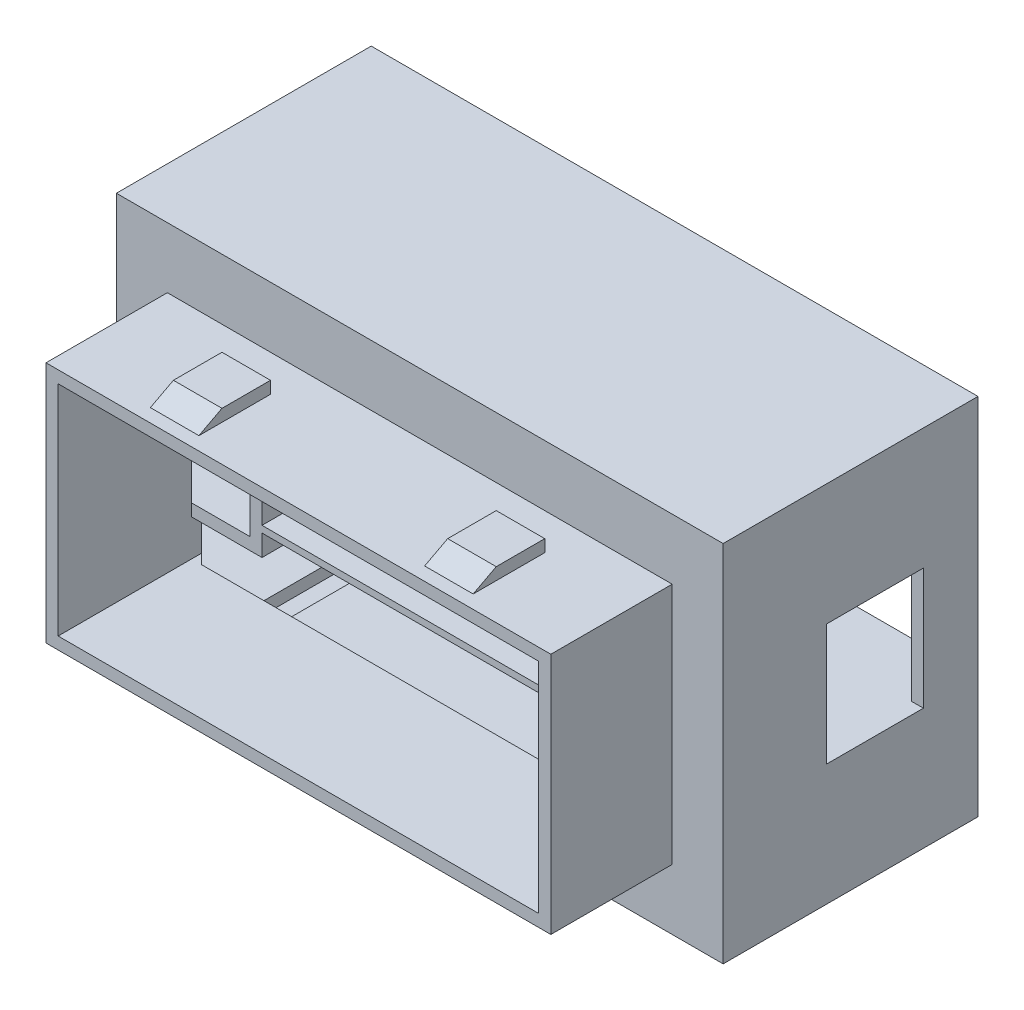
from build123d import *

# Parameters (mm, degrees)
SKETCH1_W            = 41.6
SKETCH1_H            = 20
SKETCH1_W_2          = 39.6
SKETCH1_H_2          = 18
BOSS_EXTRUDE2_DEPTH  = 10
SKETCH2_W            = 4
SKETCH2_H            = 10
BOSS_EXTRUDE3_DEPTH  = 1
SKETCH3_W            = 3
SKETCH3_H            = 1
CUT_EXTRUDE1_DEPTH   = 27
SKETCH4_W            = 4
SKETCH4_H            = 10
BOSS_EXTRUDE4_DEPTH  = 1
SKETCH5_W            = 3
SKETCH5_H            = 1
CUT_EXTRUDE2_DEPTH   = 27
SKETCH6_W            = 50
SKETCH6_H            = 30
SKETCH6_W_2          = 41.6
SKETCH6_H_2          = 20
SKETCH6_W_3          = 39.6
SKETCH6_H_3          = 18
BOSS_EXTRUDE6_DEPTH  = 1
SKETCH7_W            = 50
SKETCH7_H            = 30
SKETCH7_W_2          = 48
SKETCH7_H_2          = 28
BOSS_EXTRUDE7_DEPTH  = 20
SKETCH8_W            = 4.2
SKETCH8_H            = 1
BOSS_EXTRUDE8_DEPTH  = 20
SKETCH9_W            = 4.2
SKETCH9_H            = 1
BOSS_EXTRUDE9_DEPTH  = 20
SKETCH10_W           = 4
SKETCH10_H           = 4
BOSS_EXTRUDE10_DEPTH = 20
SKETCH11_W           = 2
SKETCH11_H           = 10
CUT_EXTRUDE3_DEPTH   = 1
SKETCH12_W           = 2
SKETCH12_H           = 10
CUT_EXTRUDE4_DEPTH   = 1
SKETCH13_R           = 1.5
CUT_EXTRUDE5_DEPTH   = 10
CHAMFER2_SIZE        = 5
CHAMFER3_SIZE        = 5
CHAMFER4_SIZE        = 4
SKETCH16_W           = 1.2
SKETCH16_H           = 1
BOSS_EXTRUDE11_DEPTH = 20
BOSS_EXTRUDE12_DEPTH = 20
SKETCH18_W           = 28
SKETCH18_H           = 0.549749779
BOSS_EXTRUDE13_DEPTH = 20


# Some blends are built 0.0001 mm under size
with BuildPart() as part:
    # Sketch1 → Boss-Extrude2 (new body)
    with BuildSketch(Plane.XY):
        Rectangle(SKETCH1_W, SKETCH1_H)
        Rectangle(SKETCH1_W_2, SKETCH1_H_2, mode=Mode.SUBTRACT)
    extrude(amount=BOSS_EXTRUDE2_DEPTH)

    # Sketch2 → Boss-Extrude3 (add)
    with BuildSketch(Plane.XZ.offset(10)):
        with Locations((-11.3, 5)):
            Rectangle(SKETCH2_W, SKETCH2_H)
        with Locations((11.3, 5)):
            Rectangle(SKETCH2_W, SKETCH2_H)
    extrude(amount=BOSS_EXTRUDE3_DEPTH)

    # Sketch3 → Cut-Extrude1 (cut)
    with BuildSketch(Plane.ZY.offset(13.3)):
        Polygon((8.900149248, -10), (7, -11), (10, -11), (10, -10), align=None)
        with Locations((1.5, -10.5)):
            Rectangle(SKETCH3_W, SKETCH3_H)
    extrude(amount=-CUT_EXTRUDE1_DEPTH, mode=Mode.SUBTRACT)

    # Sketch4 → Boss-Extrude4 (add)
    with BuildSketch(Plane(origin=(0, 10, 0), x_dir=(1, 0, 0), z_dir=(0, 1, 0))):
        with Locations((11.3, -5)):
            Rectangle(SKETCH4_W, SKETCH4_H)
        with Locations((-11.3, -5)):
            Rectangle(SKETCH4_W, SKETCH4_H)
    extrude(amount=BOSS_EXTRUDE4_DEPTH)

    # Sketch5 → Cut-Extrude2 (cut)
    with BuildSketch(Plane(origin=(13.3, 0, 0), x_dir=(0, 0, -1), z_dir=(1, 0, 0))):
        Polygon((-7, 11), (-10, 11), (-10, 10), (-8.900149248, 10), align=None)
        with Locations((-1.5, 10.5)):
            Rectangle(SKETCH5_W, SKETCH5_H)
    extrude(amount=-CUT_EXTRUDE2_DEPTH, mode=Mode.SUBTRACT)

    # Sketch6 → Boss-Extrude6 (add)
    # profile 1 of 2: a face of its own
    with BuildSketch(Plane(origin=(0, 0, 0), x_dir=(-1, 0, 0), z_dir=(0, 0, -1))):
        Rectangle(SKETCH6_W, SKETCH6_H)
        Rectangle(SKETCH6_W_2, SKETCH6_H_2, mode=Mode.SUBTRACT)
    # profile 2 of 2: a face of its own
    with BuildSketch(Plane(origin=(0, 0, 0), x_dir=(-1, 0, 0), z_dir=(0, 0, -1))):
        Rectangle(SKETCH6_W_2, SKETCH6_H_2)
        Rectangle(SKETCH6_W_3, SKETCH6_H_3, mode=Mode.SUBTRACT)
    extrude(amount=BOSS_EXTRUDE6_DEPTH)

    # Sketch7 → Boss-Extrude7 (add)
    with BuildSketch(Plane(origin=(0, 0, -1), x_dir=(-1, 0, 0), z_dir=(0, 0, -1))):
        Rectangle(SKETCH7_W, SKETCH7_H)
        Rectangle(SKETCH7_W_2, SKETCH7_H_2, mode=Mode.SUBTRACT)
    extrude(amount=BOSS_EXTRUDE7_DEPTH)

    # Sketch8 → Boss-Extrude8 (add)
    with BuildSketch(Plane(origin=(0, 0, -1), x_dir=(-1, 0, 0), z_dir=(0, 0, -1))):
        Polygon((-15, -5), (-19.8, -5), (-19.8, -6), (-14, -6), (-14, 6), (-19.8, 6), (-19.8, 5), (-15, 5), align=None)
        with Locations((-21.9, 5.5)):
            Rectangle(SKETCH8_W, SKETCH8_H)
        with Locations((-21.9, -5.5)):
            Rectangle(SKETCH8_W, SKETCH8_H)
    extrude(amount=BOSS_EXTRUDE8_DEPTH)

    # Sketch9 → Boss-Extrude9 (add)
    with BuildSketch(Plane(origin=(0, 0, -1), x_dir=(-1, 0, 0), z_dir=(0, 0, -1))):
        Polygon((15, 5), (19.8, 5), (19.8, 6), (14, 6), (14, -6), (19.8, -6), (19.8, -5), (15, -5), align=None)
        with Locations((21.9, 5.5)):
            Rectangle(SKETCH9_W, SKETCH9_H)
        with Locations((21.9, -5.5)):
            Rectangle(SKETCH9_W, SKETCH9_H)
    extrude(amount=BOSS_EXTRUDE9_DEPTH)

    # Sketch10 → Boss-Extrude10 (add)
    with BuildSketch(Plane(origin=(0, 0, -1), x_dir=(-1, 0, 0), z_dir=(0, 0, -1))):
        with Locations((-22, 12)):
            Rectangle(SKETCH10_W, SKETCH10_H)
        with Locations((22, 12)):
            Rectangle(SKETCH10_W, SKETCH10_H)
        with Locations((22, -12)):
            Rectangle(SKETCH10_W, SKETCH10_H)
        with Locations((-22, -12)):
            Rectangle(SKETCH10_W, SKETCH10_H)
    extrude(amount=BOSS_EXTRUDE10_DEPTH)

    # Sketch11 → Cut-Extrude3 (cut)
    with BuildSketch(Plane.ZY.offset(25)):
        Polygon((-10.5, -5), (-10.5, 5), (-16.5, 5), (-16.5, 0), (-16.5, -5), align=None)
        with Locations((-9.5, 0)):
            Rectangle(SKETCH11_W, SKETCH11_H)
    extrude(amount=-CUT_EXTRUDE3_DEPTH, mode=Mode.SUBTRACT)

    # Sketch12 → Cut-Extrude4 (cut)
    with BuildSketch(Plane(origin=(25, 0, 0), x_dir=(0, 0, -1), z_dir=(1, 0, 0))):
        with Locations((9.5, 0)):
            Rectangle(SKETCH12_W, SKETCH12_H)
        Polygon((16.5, 5), (10.5, 5), (10.5, -5), (16.5, -5), (16.5, 0), align=None)
    extrude(amount=-CUT_EXTRUDE4_DEPTH, mode=Mode.SUBTRACT)

    # Sketch13 → Cut-Extrude5 (cut)
    with BuildSketch(Plane(origin=(0, 0, -21), x_dir=(-1, 0, 0), z_dir=(0, 0, -1))):
        with Locations((-22.5, 12.5)):
            Circle(SKETCH13_R)
        with Locations((22.5, 12.5)):
            Circle(SKETCH13_R)
        with Locations((22.5, -12.5)):
            Circle(SKETCH13_R)
        with Locations((-22.5, -12.5)):
            Circle(SKETCH13_R)
    extrude(amount=-CUT_EXTRUDE5_DEPTH, mode=Mode.SUBTRACT)

    # Chamfer2
    chamfer2_edges = [part.edges().sort_by_distance(p)[0] for p in [
        (0, 14, -1),
        (0, -14, -1),
    ]]
    chamfer(chamfer2_edges, length=CHAMFER2_SIZE - 0.0001)  # a hair under: the kernel refuses the full size

    # Chamfer3
    # the kernel refuses this chamfer: 5 mm, written as the material it adds along each edge
    with BuildSketch(Plane(origin=(24, -21.85851494, -1), x_dir=(-0.9996219169112968, 0, 0.02749587661058636), z_dir=(0, 1, 0))) as chamfer3_piece_1_section:
        Polygon((CHAMFER3_SIZE * 0.999621916911, -CHAMFER3_SIZE * 0.0274958766106), (-CHAMFER3_SIZE * 0.0274958766106, -CHAMFER3_SIZE * 0.999621916911), (0, 0), align=None)
    chamfer3_piece_1 = extrude(amount=28.71692988, mode=Mode.PRIVATE)
    chamfer3_piece_1 = split(chamfer3_piece_1, bisect_by=Plane(origin=(19.8, -10.000025, -1.99995), z_dir=(1, 0, 0)), keep=Keep.TOP, mode=Mode.PRIVATE)
    chamfer3_piece_1 = split(chamfer3_piece_1, bisect_by=Plane(origin=(19.999975, -5, -1.99995), z_dir=(0, -1, 0)), keep=Keep.TOP, mode=Mode.PRIVATE)
    chamfer3_piece_1 = split(chamfer3_piece_1, bisect_by=Plane(origin=(19.999975, -10.0000375, -1.9999375), z_dir=(0, 0.7071067811865476, -0.7071067811865476)), keep=Keep.TOP, mode=Mode.PRIVATE)
    add(chamfer3_piece_1)
    with BuildSketch(Plane(origin=(24, -21.85851494, -1), x_dir=(-0.9996219169112968, 0, 0.02749587661058636), z_dir=(0, 1, 0))) as chamfer3_piece_2_section:
        Polygon((CHAMFER3_SIZE * 0.999621916911, -CHAMFER3_SIZE * 0.0274958766106), (-CHAMFER3_SIZE * 0.0274958766106, -CHAMFER3_SIZE * 0.999621916911), (0, 0), align=None)
    chamfer3_piece_2 = extrude(amount=28.71692988, mode=Mode.PRIVATE)
    chamfer3_piece_2 = split(chamfer3_piece_2, bisect_by=Plane(origin=(19.599975009, -9, -1.399950019), z_dir=(0, -1, 0)), keep=Keep.TOP, mode=Mode.PRIVATE)
    chamfer3_piece_2 = split(chamfer3_piece_2, bisect_by=Plane(origin=(19.599975009, -9.300037514, -1.299937514), z_dir=(0, 0.7071067811865476, -0.7071067811865476)), keep=Keep.TOP, mode=Mode.PRIVATE)
    add(chamfer3_piece_2)
    with BuildSketch(Plane(origin=(24, -21.85851494, -1), x_dir=(-0.9996219169112968, 0, 0.02749587661058636), z_dir=(0, 1, 0))) as chamfer3_piece_3_section:
        Polygon((CHAMFER3_SIZE * 0.999621916911, -CHAMFER3_SIZE * 0.0274958766106), (-CHAMFER3_SIZE * 0.0274958766106, -CHAMFER3_SIZE * 0.999621916911), (0, 0), align=None)
    chamfer3_piece_3 = extrude(amount=28.71692988, mode=Mode.PRIVATE)
    chamfer3_piece_3 = split(chamfer3_piece_3, bisect_by=Plane(origin=(19.8, 6.42920747, -1.451851852), z_dir=(1, 0, 0)), keep=Keep.TOP, mode=Mode.PRIVATE)
    chamfer3_piece_3 = split(chamfer3_piece_3, bisect_by=Plane(origin=(19.903703704, 5, -1.451851852), z_dir=(0, 1, 0)), keep=Keep.TOP, mode=Mode.PRIVATE)
    add(chamfer3_piece_3)
    with BuildSketch(Plane(origin=(-24, 21.85851494, -1), x_dir=(0.9996219169112968, 0, 0.02749587661058636), z_dir=(0, -1, 0))) as chamfer3_piece_4_section:
        Polygon((CHAMFER3_SIZE * 0.999621916911, -CHAMFER3_SIZE * 0.0274958766106), (-CHAMFER3_SIZE * 0.0274958766106, -CHAMFER3_SIZE * 0.999621916911), (0, 0), align=None)
    chamfer3_piece_4 = extrude(amount=28.71692988, mode=Mode.PRIVATE)
    chamfer3_piece_4 = split(chamfer3_piece_4, bisect_by=Plane(origin=(-19.8, 10.000025, -1.99995), z_dir=(-1, 0, 0)), keep=Keep.TOP, mode=Mode.PRIVATE)
    chamfer3_piece_4 = split(chamfer3_piece_4, bisect_by=Plane(origin=(-19.999975, 15, -1.99995), z_dir=(0, -1, 0)), keep=Keep.TOP, mode=Mode.PRIVATE)
    chamfer3_piece_4 = split(chamfer3_piece_4, bisect_by=Plane(origin=(-19.999975, 5, -1.99995), z_dir=(0, 1, 0)), keep=Keep.TOP, mode=Mode.PRIVATE)
    add(chamfer3_piece_4)
    with BuildSketch(Plane(origin=(-24, 21.85851494, -1), x_dir=(0.9996219169112968, 0, 0.02749587661058636), z_dir=(0, -1, 0))) as chamfer3_piece_5_section:
        Polygon((CHAMFER3_SIZE * 0.999621916911, -CHAMFER3_SIZE * 0.0274958766106), (-CHAMFER3_SIZE * 0.0274958766106, -CHAMFER3_SIZE * 0.999621916911), (0, 0), align=None)
    chamfer3_piece_5 = extrude(amount=28.71692988, mode=Mode.PRIVATE)
    chamfer3_piece_5 = split(chamfer3_piece_5, bisect_by=Plane(origin=(-19.599975009, 9, -1.399950019), z_dir=(0, 1, 0)), keep=Keep.TOP, mode=Mode.PRIVATE)
    chamfer3_piece_5 = split(chamfer3_piece_5, bisect_by=Plane(origin=(-19.599975009, 15, -1.399950019), z_dir=(0, -1, 0)), keep=Keep.TOP, mode=Mode.PRIVATE)
    add(chamfer3_piece_5)
    with BuildSketch(Plane(origin=(-24, 21.85851494, -1), x_dir=(0.9996219169112968, 0, 0.02749587661058636), z_dir=(0, -1, 0))) as chamfer3_piece_6_section:
        Polygon((CHAMFER3_SIZE * 0.999621916911, -CHAMFER3_SIZE * 0.0274958766106), (-CHAMFER3_SIZE * 0.0274958766106, -CHAMFER3_SIZE * 0.999621916911), (0, 0), align=None)
    chamfer3_piece_6 = extrude(amount=28.71692988, mode=Mode.PRIVATE)
    chamfer3_piece_6 = split(chamfer3_piece_6, bisect_by=Plane(origin=(-19.8, -6.42920747, -1.451851852), z_dir=(-1, 0, 0)), keep=Keep.TOP, mode=Mode.PRIVATE)
    chamfer3_piece_6 = split(chamfer3_piece_6, bisect_by=Plane(origin=(-19.903703704, -6, -1.451851852), z_dir=(0, -1, 0)), keep=Keep.TOP, mode=Mode.PRIVATE)
    add(chamfer3_piece_6)
    with BuildSketch(Plane(origin=(-24, 6.85841494, -1), x_dir=(0.9996219169112968, 0, 0.02749587661058636), z_dir=(0, -1, 0))) as chamfer3_piece_7_section:
        Polygon((CHAMFER3_SIZE * 0.999621916911, -CHAMFER3_SIZE * 0.0274958766106), (-CHAMFER3_SIZE * 0.0274958766106, -CHAMFER3_SIZE * 0.999621916911), (0, 0), align=None)
    chamfer3_piece_7 = extrude(amount=28.71692988, mode=Mode.PRIVATE)
    chamfer3_piece_7 = split(chamfer3_piece_7, bisect_by=Plane(origin=(-19.8, 6.42920747, -1.451851852), z_dir=(-1, 0, 0)), keep=Keep.TOP, mode=Mode.PRIVATE)
    chamfer3_piece_7 = split(chamfer3_piece_7, bisect_by=Plane(origin=(-19.903703704, 5, -1.451851852), z_dir=(0, 1, 0)), keep=Keep.TOP, mode=Mode.PRIVATE)
    add(chamfer3_piece_7)
    with BuildSketch(Plane(origin=(-24, -6, -1), x_dir=(0.9996219169112968, 0, 0.02749587661058636), z_dir=(0, -1, 0))) as chamfer3_piece_8_section:
        Polygon((CHAMFER3_SIZE * 0.999621916911, -CHAMFER3_SIZE * 0.0274958766106), (-CHAMFER3_SIZE * 0.0274958766106, -CHAMFER3_SIZE * 0.999621916911), (0, 0), align=None)
    chamfer3_piece_8 = extrude(amount=15.85851494, mode=Mode.PRIVATE)
    chamfer3_piece_8 = split(chamfer3_piece_8, bisect_by=Plane(origin=(-19.8, -7.5, -1.451851852), z_dir=(-1, 0, 0)), keep=Keep.TOP, mode=Mode.PRIVATE)
    chamfer3_piece_8 = split(chamfer3_piece_8, bisect_by=Plane(origin=(-19.903703704, -8.475975926, -0.475875926), z_dir=(0, 0.7071067811865476, -0.7071067811865476)), keep=Keep.TOP, mode=Mode.PRIVATE)
    add(chamfer3_piece_8)
    with BuildSketch(Plane(origin=(-24, 6.85841494, -1), x_dir=(0.9996219169112968, 0, 0.02749587661058636), z_dir=(0, -1, 0))) as chamfer3_piece_9_section:
        Polygon((CHAMFER3_SIZE * 0.999621916911, -CHAMFER3_SIZE * 0.0274958766106), (-CHAMFER3_SIZE * 0.0274958766106, -CHAMFER3_SIZE * 0.999621916911), (0, 0), align=None)
    chamfer3_piece_9 = extrude(amount=28.71692988, mode=Mode.PRIVATE)
    chamfer3_piece_9 = split(chamfer3_piece_9, bisect_by=Plane(origin=(-19.599975009, -9, -1.399950019), z_dir=(0, -1, 0)), keep=Keep.TOP, mode=Mode.PRIVATE)
    chamfer3_piece_9 = split(chamfer3_piece_9, bisect_by=Plane(origin=(-19.599975009, -9.300037514, -1.299937514), z_dir=(0, 0.7071067811865476, -0.7071067811865476)), keep=Keep.TOP, mode=Mode.PRIVATE)
    add(chamfer3_piece_9)
    with BuildSketch(Plane(origin=(24, -6.85841494, -1), x_dir=(-0.9996219169112968, 0, 0.02749587661058636), z_dir=(0, 1, 0))) as chamfer3_piece_10_section:
        Polygon((CHAMFER3_SIZE * 0.999621916911, -CHAMFER3_SIZE * 0.0274958766106), (-CHAMFER3_SIZE * 0.0274958766106, -CHAMFER3_SIZE * 0.999621916911), (0, 0), align=None)
    chamfer3_piece_10 = extrude(amount=28.71692988, mode=Mode.PRIVATE)
    chamfer3_piece_10 = split(chamfer3_piece_10, bisect_by=Plane(origin=(19.8, -6.42920747, -1.451851852), z_dir=(1, 0, 0)), keep=Keep.TOP, mode=Mode.PRIVATE)
    chamfer3_piece_10 = split(chamfer3_piece_10, bisect_by=Plane(origin=(19.903703704, -5, -1.451851852), z_dir=(0, -1, 0)), keep=Keep.TOP, mode=Mode.PRIVATE)
    add(chamfer3_piece_10)
    with BuildSketch(Plane(origin=(24, -6.85841494, -1), x_dir=(-0.9996219169112968, 0, 0.02749587661058636), z_dir=(0, 1, 0))) as chamfer3_piece_11_section:
        Polygon((CHAMFER3_SIZE * 0.999621916911, -CHAMFER3_SIZE * 0.0274958766106), (-CHAMFER3_SIZE * 0.0274958766106, -CHAMFER3_SIZE * 0.999621916911), (0, 0), align=None)
    chamfer3_piece_11 = extrude(amount=28.71692988, mode=Mode.PRIVATE)
    chamfer3_piece_11 = split(chamfer3_piece_11, bisect_by=Plane(origin=(19.8, 7.5, -1.451851852), z_dir=(1, 0, 0)), keep=Keep.TOP, mode=Mode.PRIVATE)
    chamfer3_piece_11 = split(chamfer3_piece_11, bisect_by=Plane(origin=(19.903703704, 15, -1.451851852), z_dir=(0, -1, 0)), keep=Keep.TOP, mode=Mode.PRIVATE)
    chamfer3_piece_11 = split(chamfer3_piece_11, bisect_by=Plane(origin=(19.903703704, 5, -1.451851852), z_dir=(0, 1, 0)), keep=Keep.TOP, mode=Mode.PRIVATE)
    add(chamfer3_piece_11)
    with BuildSketch(Plane(origin=(24, -6.85841494, -1), x_dir=(-0.9996219169112968, 0, 0.02749587661058636), z_dir=(0, 1, 0))) as chamfer3_piece_12_section:
        Polygon((CHAMFER3_SIZE * 0.999621916911, -CHAMFER3_SIZE * 0.0274958766106), (-CHAMFER3_SIZE * 0.0274958766106, -CHAMFER3_SIZE * 0.999621916911), (0, 0), align=None)
    chamfer3_piece_12 = extrude(amount=28.71692988, mode=Mode.PRIVATE)
    chamfer3_piece_12 = split(chamfer3_piece_12, bisect_by=Plane(origin=(19.599975009, 9, -1.399950019), z_dir=(0, 1, 0)), keep=Keep.TOP, mode=Mode.PRIVATE)
    chamfer3_piece_12 = split(chamfer3_piece_12, bisect_by=Plane(origin=(19.599975009, 15, -1.399950019), z_dir=(0, -1, 0)), keep=Keep.TOP, mode=Mode.PRIVATE)
    add(chamfer3_piece_12)

    # Chamfer4
    chamfer4_edges = [part.edges().sort_by_distance(p)[0] for p in [
        (24, 0, -1),
        (-24, 0, -1),
    ]]
    chamfer(chamfer4_edges, length=CHAMFER4_SIZE)

    # Sketch16 → Boss-Extrude11 (add)
    with BuildSketch(Plane(origin=(0, 0, -21), x_dir=(-1, 0, 0), z_dir=(0, 0, -1))):
        with Locations((-13.4, 0.5)):
            Rectangle(SKETCH16_W, SKETCH16_H)
        with Locations((-13.4, -1.5)):
            Rectangle(SKETCH16_W, SKETCH16_H)
        with Locations((13.4, 0.5)):
            Rectangle(SKETCH16_W, SKETCH16_H)
        Polygon((13, -1), (12.8, -1), (12.8, -2), (14, -2), (14, -1), align=None)
    extrude(amount=-BOSS_EXTRUDE11_DEPTH)

    # Sketch17 → Boss-Extrude12 (add)
    with BuildSketch(Plane(origin=(0, 0, -21), x_dir=(-1, 0, 0), z_dir=(0, 0, -1))):
        Polygon((-20, -10), (-20, -10.5), (-16.744161901, -10.5), (12.056353702, -10.5), (12.056353702, -9.5), (-24, -9.5), (-24, -10), align=None)
        Polygon((14.342415664, -9.5), (14.342415664, -10.5), (20, -10.5), (20, -10), (24, -10), (24, -9.5), align=None)
    extrude(amount=-BOSS_EXTRUDE12_DEPTH)

    # Sketch18 → Boss-Extrude13 (add)
    with BuildSketch(Plane(origin=(0, 0, -21), x_dir=(-1, 0, 0), z_dir=(0, 0, -1))):
        with Locations((0, -3.97487489)):
            Rectangle(SKETCH18_W, SKETCH18_H)
    extrude(amount=-BOSS_EXTRUDE13_DEPTH)


solid = part.part
